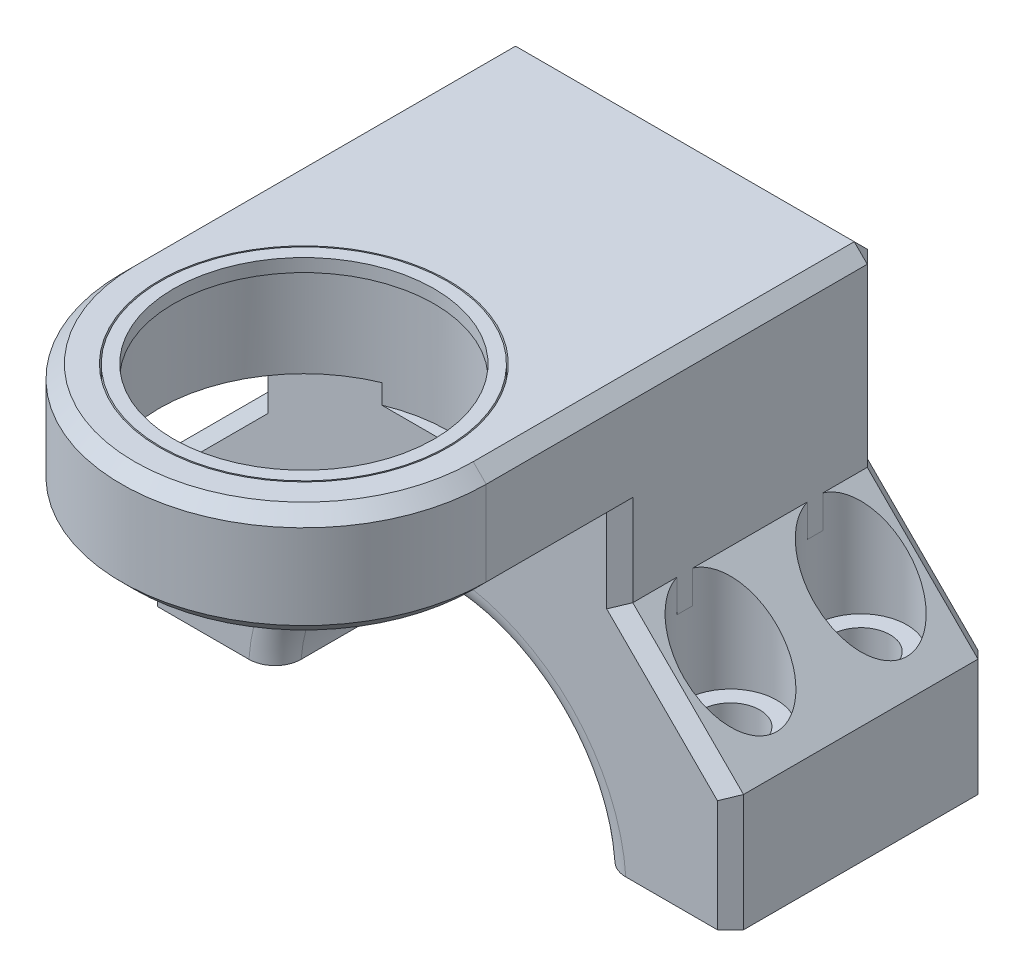
from build123d import *

# Parameters (mm, degrees)
BOSS_EXTRUDE1_DEPTH      = 23
CUT_EXTRUDE1_REACH       = 39.885
CUT_EXTRUDE2_REACH       = 35.693
SKETCH3_R                = 2.25
CUT_EXTRUDE3_START       = 23
SKETCH4_R                = 3.55
CUT_EXTRUDE3_DEPTH       = 13
FILLET1_R                = 2
CHAMFER1_SIZE            = 13
BOSS_EXTRUDE2_DEPTH      = 10
BOSS_EXTRUDE2_DEPTH_BACK = 7
SKETCH6_R                = 11.1
CUT_EXTRUDE4_START       = -128
SKETCH7_W                = 24.25
SKETCH7_H                = 8.5
CUT_EXTRUDE4_DEPTH       = 28
EXTRUDE_THIN1_START      = -10
SKETCH8_R                = 11
SKETCH8_R_2              = 10
EXTRUDE_THIN1_DEPTH      = 1
CHAMFER2_SIZE            = 1
CUT_EXTRUDE5_DEPTH       = 10
CUT_EXTRUDE5_DEPTH_BACK  = 10
SKETCH9_W                = 45
SKETCH9_H                = 1


with BuildPart() as part:
    # Sketch1 → Boss-Extrude1 (new body)
    with BuildSketch(Plane(origin=(0, 0, 0), x_dir=(1, 0, 0), z_dir=(0, 1, 0))):
        Polygon((0, 10), (-22.5, 10), (-22.5, -10), (22.5, -10), (22.5, 10), align=None)
    extrude(amount=BOSS_EXTRUDE1_DEPTH)

    # Sketch2 → Cut-Extrude1 (cut, up to next)
    with BuildSketch(Plane.XY.offset(10), mode=Mode.PRIVATE) as cut_extrude1_sk1:
        with BuildLine():
            Line((-12.5, 0), (-22.5, 0))
            Line((-22.5, 0), (-22.5, -2.522641864))
            Line((-22.5, -2.522641864), (22.5, -2.522641864))
            Line((22.5, -2.522641864), (22.5, 0))
            Line((22.5, 0), (12.5, 0))
            ThreePointArc((12.5, 0), (0, 12.5), (-12.5, 0))
        make_face()
    cut_extrude1_tool1 = extrude(cut_extrude1_sk1.sketch, amount=-CUT_EXTRUDE1_REACH, mode=Mode.PRIVATE) & part.part
    add(cut_extrude1_tool1.solids().sort_by_distance((0, 3.22853, 10))[0], mode=Mode.SUBTRACT)

    # Sketch3 → Cut-Extrude2 (cut, up to next)
    with BuildSketch(Plane(origin=(0, 0, 0), x_dir=(1, 0, 0), z_dir=(0, 1, 0)), mode=Mode.PRIVATE) as cut_extrude2_sk1:
        with Locations(Location((-17.5, -5, 0), (0, 0, 270))):
            Circle(SKETCH3_R)
    cut_extrude2_tool1 = extrude(cut_extrude2_sk1.sketch, amount=CUT_EXTRUDE2_REACH, mode=Mode.PRIVATE) & part.part
    # Sketch3 → Cut-Extrude2 (cut, up to next)
    with BuildSketch(Plane(origin=(0, 0, 0), x_dir=(1, 0, 0), z_dir=(0, 1, 0)), mode=Mode.PRIVATE) as cut_extrude2_sk2:
        with Locations(Location((-17.5, 5, 0), (0, 0, 270))):
            Circle(SKETCH3_R)
    cut_extrude2_tool2 = extrude(cut_extrude2_sk2.sketch, amount=CUT_EXTRUDE2_REACH, mode=Mode.PRIVATE) & part.part
    cut_extrude2_1 = cut_extrude2_tool1.solids().sort_by_distance((-17.5, 0, 5))[0]
    add(cut_extrude2_1, mode=Mode.SUBTRACT)
    cut_extrude2_2 = cut_extrude2_tool2.solids().sort_by_distance((-17.5, 0, -5))[0]
    add(cut_extrude2_2, mode=Mode.SUBTRACT)
    cut_extrude2 = cut_extrude2_1 + cut_extrude2_2  # Cut-Extrude2 as one shape, for the pattern or mirror that repeats it

    # Mirror1: Cut-Extrude2 across plane
    add(cut_extrude2.mirror(Plane(origin=(0, 0, 0), x_dir=(0, 0, 1), z_dir=(1, 0, 0))), mode=Mode.SUBTRACT)

    # Sketch4 → Cut-Extrude3 (cut)
    with BuildSketch(Plane(origin=(0, 0, 0), x_dir=(1, 0, 0), z_dir=(0, 1, 0)).offset(CUT_EXTRUDE3_START)):
        with Locations(Location((-17.5, 5, 0), (0, 0, 270))):
            Circle(SKETCH4_R)
        with Locations(Location((-17.5, -5, 0), (0, 0, 270))):
            Circle(SKETCH4_R)
    cut_extrude3 = extrude(amount=-CUT_EXTRUDE3_DEPTH, mode=Mode.SUBTRACT)

    # Mirror2: Cut-Extrude3 across plane
    add(cut_extrude3.mirror(Plane(origin=(0, 0, 0), x_dir=(0, 0, 1), z_dir=(1, 0, 0))), mode=Mode.SUBTRACT)

    # Fillet1
    fillet1_edges = [part.edges().sort_by_distance(p)[0] for p in [
        (0, 12.5, 10),
        (0, 12.5, -10),
    ]]
    fillet(fillet1_edges, radius=FILLET1_R)

    # Chamfer1
    # the kernel refuses this chamfer: 13 mm, written as the material it takes off along each edge
    with BuildSketch(Plane(origin=(-22.5, 23, -43.431878844), x_dir=(0.9996219169112968, 0.027495876610586424, 0), z_dir=(0, 0, 1))) as chamfer1_piece_1:
        Polygon((CHAMFER1_SIZE * 0.999621916911, -CHAMFER1_SIZE * 0.0274958766106), (-CHAMFER1_SIZE * 0.0274958766106, -CHAMFER1_SIZE * 0.999621916911), (0, 0), align=None)
    extrude(amount=86.863757687, mode=Mode.SUBTRACT)
    with BuildSketch(Plane(origin=(22.5, 23, 43.431878844), x_dir=(0.027495876610586424, -0.9996219169112968, 0), z_dir=(0, 0, -1))) as chamfer1_piece_2:
        Polygon((CHAMFER1_SIZE * 0.999621916911, CHAMFER1_SIZE * 0.0274958766106), (-CHAMFER1_SIZE * 0.0274958766106, CHAMFER1_SIZE * 0.999621916911), (0, 0), align=None)
    extrude(amount=86.863757687, mode=Mode.SUBTRACT)

    # Sketch6 → Boss-Extrude2 (add, two sides: drawn at the far end of the back side and taken through both)
    with BuildSketch(Plane(origin=(0, 23, 0), x_dir=(1, 0, 0), z_dir=(0, 1, 0)).offset(-BOSS_EXTRUDE2_DEPTH_BACK)):
        with BuildLine():
            ThreePointArc((14, -20.25), (0, -34.25), (-14, -20.25))
            Line((-14, -20.25), (-14, -10))
            Line((-14, -10), (-14, 10))
            Line((-14, 10), (14, 10))
            Line((14, 10), (14, -10))
            Line((14, -10), (14, -20.25))
        make_face()
        with Locations(Location((0, -20.25, 0), (0, 0, 270))):
            Circle(SKETCH6_R, mode=Mode.SUBTRACT)
    extrude(amount=BOSS_EXTRUDE2_DEPTH + BOSS_EXTRUDE2_DEPTH_BACK)

    # Sketch7 → Cut-Extrude4 (cut)
    with BuildSketch(Plane(origin=(114, 0, 0), x_dir=(0, 0, -1), z_dir=(1, 0, 0)).offset(CUT_EXTRUDE4_START)):
        with Locations((-22.125, 20.25)):
            Rectangle(SKETCH7_W, SKETCH7_H)
    extrude(amount=CUT_EXTRUDE4_DEPTH, mode=Mode.SUBTRACT)

    # Chamfer2
    chamfer2_edges = [part.edges().sort_by_distance(p)[0] for p in [
        (14, 25.75, -10),
        (14, 33, 5.125),
        (-14, 33, 5.125),
        (0, 33, 34.25),
        (-14, 25.75, -10),
        (0, 33, -10),
        (-14, 24.5, 15.125),
        (0, 24.5, 34.25),
        (14, 24.5, 15.125),
        (14, 21.5, 10),
        (-14, 21.5, 10),
        (-22.5, 5, -10),
        (22.5, 5, -10),
        (-18.25, 14.25, -10),
        (22.5, 5, 10),
        (-22.5, 5, 10),
        (18.25, 14.25, 10),
        (-18.25, 14.25, 10),
        (18.25, 14.25, -10),
    ]]
    chamfer(chamfer2_edges, length=CHAMFER2_SIZE)

    # Sketch9 → Cut-Extrude5 (cut, two sides: drawn at the far end of the back side and taken through both)
    with BuildSketch(Plane.XY.offset(-CUT_EXTRUDE5_DEPTH_BACK)):
        with Locations((0, 0.5)):
            Rectangle(SKETCH9_W, SKETCH9_H)
    extrude(amount=CUT_EXTRUDE5_DEPTH + CUT_EXTRUDE5_DEPTH_BACK, mode=Mode.SUBTRACT)


with BuildPart() as body_2:
    # Sketch8 → Extrude-Thin1 (new body)
    with BuildSketch(Plane(origin=(0, 43, 0), x_dir=(1, 0, 0), z_dir=(0, 1, 0)).offset(EXTRUDE_THIN1_START)):
        with Locations((0, -20.25)):
            Circle(SKETCH8_R)
        with Locations((0, -20.25)):
            Circle(SKETCH8_R_2, mode=Mode.SUBTRACT)
    extrude(amount=-EXTRUDE_THIN1_DEPTH)


solid = Compound([part.part, body_2.part])
